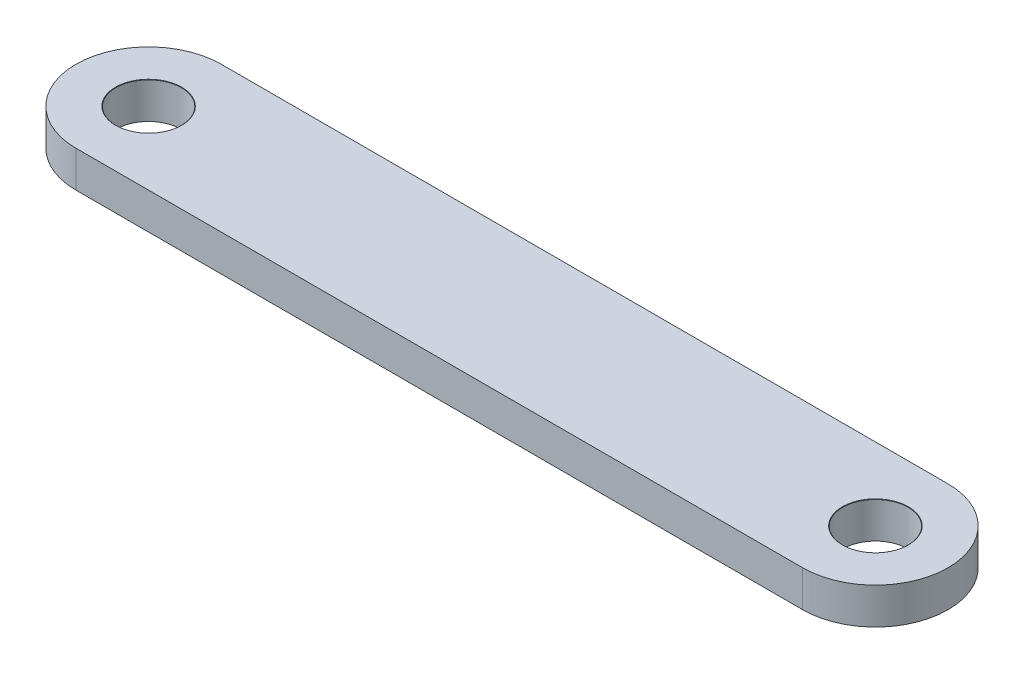
from build123d import *

# Parameters (mm, degrees)
BOSS_EXTRUDE1_DEPTH = 2.5


# Read off the part's stored shape, not the designer's step: M4 Clearance Hole1
with BuildPart() as part:
    # Sketch1 → Boss-Extrude1 (new body)
    with BuildSketch(Plane(origin=(0, 0, 0), x_dir=(1, 0, 0), z_dir=(0, 1, 0))):
        with BuildLine():
            Line((-25, 5), (25, 5))
            ThreePointArc((25, 5), (30, 0), (25, -5))
            Line((25, -5), (-25, -5))
            ThreePointArc((-25, -5), (-30, 0), (-25, 5))
        make_face()
    extrude(amount=BOSS_EXTRUDE1_DEPTH)

    # M4 Clearance Hole1 outline → M4 Clearance Hole1 (revolve, cut)
    with BuildSketch(Plane(origin=(-25, 0, 0), x_dir=(1, 0, 0), z_dir=(0, 0, 1))):
        Polygon((0, 0), (2.25, 0), (2.25, 2.479022509), (2.275, 2.5), (0, 2.5), align=None)
    revolve(axis=Axis((-25, 0, 0), (0, 1, 0)), mode=Mode.SUBTRACT)

    # M4 Clearance Hole1 2 outline → M4 Clearance Hole1 2 (revolve, cut)
    with BuildSketch(Plane(origin=(25, 0, 0), x_dir=(1, 0, 0), z_dir=(0, 0, 1))):
        Polygon((0, 0), (2.25, 0), (2.25, 2.479022509), (2.275, 2.5), (0, 2.5), align=None)
    revolve(axis=Axis((25, 0, 0), (0, 1, 0)), mode=Mode.SUBTRACT)


solid = part.part
